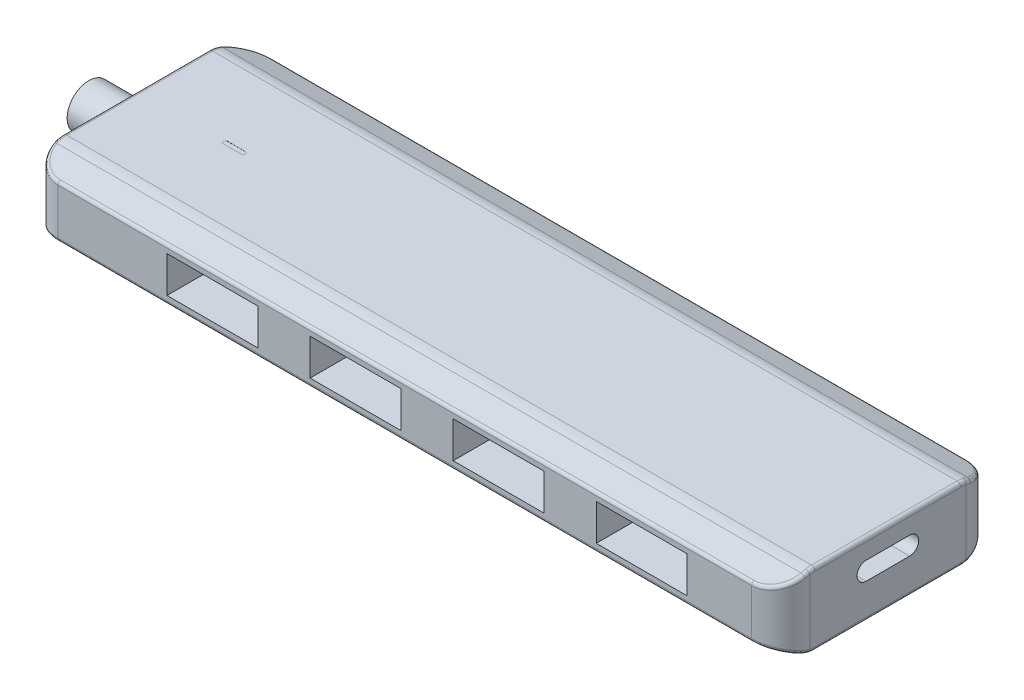
from build123d import *

# Parameters (mm, degrees)
SKETCH_1_W          = 103.5
SKETCH_1_H          = 29.5
EXTRUDE_1_DEPTH     = 10
FILLET_1_R          = 4
CUT_EXTRUDE_1_DEPTH = 118.955010723
FILLET_2_R          = 4
SKETCH_3_R          = 3
EXTRUDE_2_DEPTH     = 6.5
CUT_EXTRUDE_2_DEPTH = 6.5
CUT_EXTRUDE_3_DEPTH = 6.5
CUT_EXTRUDE_4_DEPTH = 0.01
FILLET_3_R          = 0.5


with BuildPart() as part:
    # 草图1 → 凸台-拉伸1 (new body)
    with BuildSketch(Plane(origin=(0, 0, 0), x_dir=(1, 0, 0), z_dir=(0, 1, 0))):
        with Locations((90.30430719, 40.937831299)):
            Rectangle(SKETCH_1_W, SKETCH_1_H)
    extrude(amount=EXTRUDE_1_DEPTH)

    # 圆角1
    fillet_1_edges = [part.edges().sort_by_distance(p)[0] for p in [
        (38.55430719, 5, -26.187831299),
        (38.55430719, 5, -55.687831299),
        (142.05430719, 5, -26.187831299),
        (142.05430719, 5, -55.687831299),
    ]]
    fillet(fillet_1_edges, radius=FILLET_1_R)

    # 草图2 → 切除-拉伸1 (cut, through all)
    with BuildSketch(Plane(origin=(142.05430719, 0, 0), x_dir=(0, 0, -1), z_dir=(1, 0, 0))):
        Polygon((26.187831299, 10), (26.187831299, 8.5), (30.187831299, 10), align=None)
        Polygon((30.187831299, 0), (26.187831299, 1.5), (26.187831299, 0), align=None)
        Polygon((55.687831299, 0), (55.687831299, 1.5), (51.687831299, 0), align=None)
        Polygon((51.687831299, 10), (55.687831299, 8.5), (55.687831299, 10), align=None)
    extrude(amount=-CUT_EXTRUDE_1_DEPTH, mode=Mode.SUBTRACT)

    # 圆角2
    fillet_2_edges = [part.edges().sort_by_distance(p)[0] for p in [
        (90.30430719, 0, -51.687831299),
        (90.30430719, 0, -30.187831299),
        (90.30430719, 10, -51.687831299),
        (90.30430719, 10, -30.187831299),
    ]]
    fillet(fillet_2_edges, radius=FILLET_2_R)

    # 草图3 → 凸台-拉伸2 (add)
    with BuildSketch(Plane.ZY.offset(-38.55430719)):
        with Locations((-40.937831299, 5)):
            Circle(SKETCH_3_R)
    extrude(amount=EXTRUDE_2_DEPTH)

    # 草图4 → 切除-拉伸2 (cut)
    with BuildSketch(Plane.XY.offset(-26.187831299)):
        Polygon((57.55430719, 5), (57.55430719, 7.5), (70.05430719, 7.5), (70.05430719, 2.5), (57.55430719, 2.5), align=None)
        Polygon((89.75430719, 7.5), (89.75430719, 2.5), (77.25430719, 2.5), (77.25430719, 5), (77.25430719, 7.5), align=None)
        Polygon((109.45430719, 7.5), (109.45430719, 2.5), (96.95430719, 2.5), (96.95430719, 5), (96.95430719, 7.5), align=None)
        Polygon((116.65430719, 2.5), (116.65430719, 5), (116.65430719, 7.5), (129.15430719, 7.5), (129.15430719, 2.5), align=None)
    extrude(amount=-CUT_EXTRUDE_2_DEPTH, mode=Mode.SUBTRACT)

    # 草图5 → 切除-拉伸3 (cut)
    with BuildSketch(Plane(origin=(142.05430719, 0, 0), x_dir=(0, 0, -1), z_dir=(1, 0, 0))):
        with BuildLine():
            Line((40.937831299, 4.8), (37.937831299, 4.8))
            ThreePointArc((37.937831299, 4.8), (36.687831299, 6.05), (37.937831299, 7.3))
            Line((37.937831299, 7.3), (43.937831299, 7.3))
            ThreePointArc((43.937831299, 7.3), (45.187831299, 6.05), (43.937831299, 4.8))
            Line((43.937831299, 4.8), (40.937831299, 4.8))
        make_face()
    extrude(amount=-CUT_EXTRUDE_3_DEPTH, mode=Mode.SUBTRACT)

    # 草图6 → 切除-拉伸4 (cut)
    with BuildSketch(Plane(origin=(0, 10, 0), x_dir=(1, 0, 0), z_dir=(0, 1, 0))):
        with BuildLine():
            Line((53.25430719, 41.237831299), (50.85430719, 41.237831299))
            ThreePointArc((50.85430719, 41.237831299), (50.55430719, 40.937831299), (50.85430719, 40.637831299))
            Line((50.85430719, 40.637831299), (53.25430719, 40.637831299))
            ThreePointArc((53.25430719, 40.637831299), (53.55430719, 40.937831299), (53.25430719, 41.237831299))
        make_face()
    extrude(amount=-CUT_EXTRUDE_4_DEPTH, mode=Mode.SUBTRACT)

    # 圆角3
    fillet_3_edges = [part.edges().sort_by_distance(p)[0] for p in [
        (39.935930928, 1.133970842, -27.163909053),
        (38.569200023, 0.145820581, -29.842982258),
        (38.55430719, 0.016613038, -30.548987921),
        (38.55430719, 0, -40.937831299),
        (38.55430719, 0.016613038, -51.326674677),
        (38.569200023, 0.145820581, -52.03268034),
        (39.935930928, 1.133970842, -54.711753545),
        (90.30430719, 1.5, -55.687831299),
        (140.672683453, 1.133970842, -54.711753545),
        (142.039414358, 0.14582058, -52.03268034),
        (142.05430719, 0.016613038, -51.326674677),
        (142.05430719, 0, -40.937831299),
        (142.05430719, 0.016613038, -30.548987921),
        (142.039414358, 0.145820581, -29.842982258),
        (140.672683453, 1.133970842, -27.163909053),
        (39.935930928, 8.866029158, -27.163909053),
        (38.569200023, 9.854179419, -29.842982258),
        (38.55430719, 9.983386962, -30.548987921),
        (38.55430719, 10, -40.937831299),
        (38.55430719, 9.983386962, -51.326674677),
        (38.569200023, 9.854179419, -52.03268034),
        (39.935930928, 8.866029158, -54.711753545),
        (90.30430719, 8.5, -55.687831299),
        (140.672683453, 8.866029158, -54.711753545),
        (142.039414358, 9.85417942, -52.03268034),
        (142.05430719, 9.983386962, -51.326674677),
        (142.05430719, 10, -40.937831299),
        (142.05430719, 9.983386962, -30.548987921),
        (142.039414358, 9.854179419, -29.842982258),
        (140.672683453, 8.866029158, -27.163909053),
        (90.30430719, 1.5, -26.187831299),
        (90.30430719, 8.5, -26.187831299),
    ]]
    fillet(fillet_3_edges, radius=FILLET_3_R)


solid = part.part
